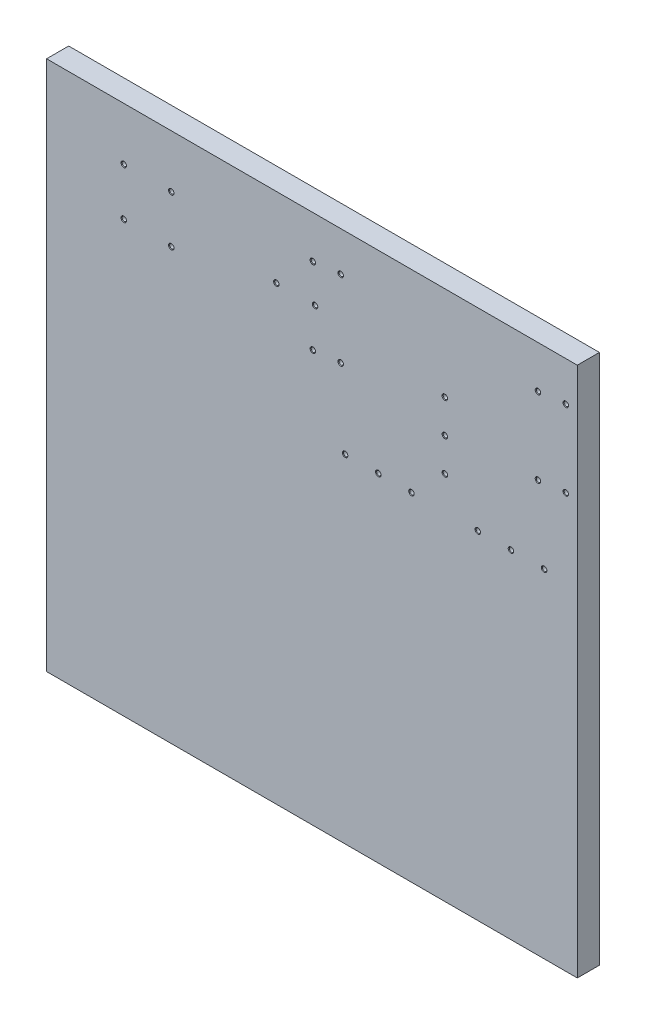
from build123d import *

# Parameters (mm, degrees)
SKETCH1_W                            = 304.8
SKETCH1_H                            = 304.8
BOSS_EXTRUDE1_DEPTH                  = 12.7
SKETCH2_W                            = 12.7
SKETCH2_H                            = 304.8
BOSS_EXTRUDE2_DEPTH                  = 304.8
SKETCH3_W                            = 609.6
SKETCH3_H                            = 12.7
BOSS_EXTRUDE3_DEPTH                  = 254
SKETCH4_W                            = 609.6
SKETCH4_H                            = 12.7
BOSS_EXTRUDE4_DEPTH                  = 50.8
F_8_0_199_DIAMETER_HOLE2_D           = 5.0546
F_8_0_199_DIAMETER_HOLE2_DEPTH       = 8.382
F_8_0_199_DIAMETER_HOLE2_CSINK_D     = 6.3246
F_8_0_199_DIAMETER_HOLE2_CSINK_ANGLE = 90
F_8_0_199_DIAMETER_HOLE2_TIP         = 1.518555042
F_8_0_199_DIAMETER_HOLE3_AT_2_COUNT  = 2
F_8_0_199_DIAMETER_HOLE3_AT_2_PITCH  = 32.173890346
LPATTERN1_COUNT                      = 2
LPATTERN1_PITCH                      = 258.572
LPATTERN1_COUNT_DIR2                 = 2
LPATTERN1_PITCH_DIR2                 = 88.138
F_8_0_199_DIAMETER_HOLE4_D           = 5.0546
F_8_0_199_DIAMETER_HOLE4_DEPTH       = 8.382
F_8_0_199_DIAMETER_HOLE4_CSINK_D     = 6.3246
F_8_0_199_DIAMETER_HOLE4_CSINK_ANGLE = 90
F_8_0_199_DIAMETER_HOLE4_TIP         = 1.518555042
F_8_0_199_DIAMETER_HOLE6_D           = 5.0546
F_8_0_199_DIAMETER_HOLE6_DEPTH       = 8.382
F_8_0_199_DIAMETER_HOLE6_CSINK_D     = 6.3246
F_8_0_199_DIAMETER_HOLE6_CSINK_ANGLE = 90
F_8_0_199_DIAMETER_HOLE6_TIP         = 1.518555042
SKETCH26_W                           = 609.6
SKETCH26_H                           = 609.6
BOSS_EXTRUDE5_DEPTH                  = 12.7


with BuildPart() as part:
    # Sketch1 → Boss-Extrude1 (new body)
    with BuildSketch(Plane.XY):
        with Locations((-60.739130435, 60.186956522)):
            Rectangle(SKETCH1_W, SKETCH1_H)
    extrude(amount=BOSS_EXTRUDE1_DEPTH)

    # Sketch2 → Boss-Extrude2 (add)
    with BuildSketch(Plane.ZY.offset(213.139130435)):
        with Locations((6.35, 60.186956522)):
            Rectangle(SKETCH2_W, SKETCH2_H)
    extrude(amount=BOSS_EXTRUDE2_DEPTH)

    # Sketch3 → Boss-Extrude3 (add)
    with BuildSketch(Plane.XZ.offset(92.213043478)):
        with Locations((-213.139130435, 6.35)):
            Rectangle(SKETCH3_W, SKETCH3_H)
    extrude(amount=BOSS_EXTRUDE3_DEPTH)

    # Sketch4 → Boss-Extrude4 (add)
    with BuildSketch(Plane(origin=(0, 212.586956522, 0), x_dir=(1, 0, 0), z_dir=(0, 1, 0))):
        with Locations((-213.139130435, -6.35)):
            Rectangle(SKETCH4_W, SKETCH4_H)
    extrude(amount=BOSS_EXTRUDE4_DEPTH)

    # #8 (0.199) Diameter Hole2
    with Locations(Plane.XY.offset(12.7)):
        with Locations((53.560869565, 41.390956522), (15.460869565, 41.390956522), (-22.639130435, 41.390956522), (-98.839130435, 41.390956522), (-136.939130435, 41.390956522), (-175.039130435, 41.390956522), (-60.485130435, 79.236956522), (-60.485130435, 117.336956522), (-60.485130435, 155.436956522)):
            CounterSinkHole(F_8_0_199_DIAMETER_HOLE2_D / 2, F_8_0_199_DIAMETER_HOLE2_CSINK_D / 2, depth=F_8_0_199_DIAMETER_HOLE2_DEPTH, counter_sink_angle=F_8_0_199_DIAMETER_HOLE2_CSINK_ANGLE)
            with Locations((0, 0, -(F_8_0_199_DIAMETER_HOLE2_DEPTH + F_8_0_199_DIAMETER_HOLE2_TIP / 2))):  # 118° drill point
                Cone(0, F_8_0_199_DIAMETER_HOLE2_D / 2, F_8_0_199_DIAMETER_HOLE2_TIP, mode=Mode.SUBTRACT)

    # Sketch15 → #8 (0.199) Diameter Hole3 (revolve, cut)
    with BuildSketch(Plane(origin=(78.452869565, 217.920956522, 12.7), x_dir=(0, -1, 0), z_dir=(1, 0, 0))):
        Polygon((0, 0), (0, 9.900555042), (2.5273, 8.382), (2.5273, 0.635), (3.1623, 0), align=None)
    f_8_0_199_diameter_hole3 = revolve(axis=Axis((78.452869565, 217.920956522, 19.05), (0, 0, -1)), mode=Mode.SUBTRACT)

    # #8 (0.199) Diameter Hole3 at 2: #8 (0.199) Diameter Hole3 ×2
    with Locations(*[Vector(-0.994719620654259, -0.102629802130995, 0) * (i * F_8_0_199_DIAMETER_HOLE3_AT_2_PITCH) for i in range(1, F_8_0_199_DIAMETER_HOLE3_AT_2_COUNT)]):
        add(f_8_0_199_diameter_hole3, mode=Mode.SUBTRACT)

    # LPattern1: 8 _0.199_ Diameter Hole3 2 × 2
    with Locations(*[(-i * LPATTERN1_PITCH, -j * LPATTERN1_PITCH_DIR2, 0) for i in range(LPATTERN1_COUNT) for j in range(LPATTERN1_COUNT_DIR2) if (i, j) != (0, 0)]):
        add(f_8_0_199_diameter_hole3, mode=Mode.SUBTRACT)

    # LPattern1 copy 1 sketch → LPattern1 copy 1 (revolve, cut)
    with BuildSketch(Plane(origin=(46.448869565, 126.480956522, 12.7), x_dir=(0, -1, 0), z_dir=(1, 0, 0))):
        Polygon((0, 0), (0, 9.900555042), (2.5273, 8.382), (2.5273, 0.635), (3.1623, 0), align=None)
    revolve(axis=Axis((46.448869565, 126.480956522, 19.05), (0, 0, -1)), mode=Mode.SUBTRACT)

    # LPattern1 copy 2 sketch → LPattern1 copy 2 (revolve, cut)
    with BuildSketch(Plane(origin=(-212.123130435, 214.618956522, 12.7), x_dir=(0, -1, 0), z_dir=(1, 0, 0))):
        Polygon((0, 0), (0, 9.900555042), (2.5273, 8.382), (2.5273, 0.635), (3.1623, 0), align=None)
    revolve(axis=Axis((-212.123130435, 214.618956522, 19.05), (0, 0, -1)), mode=Mode.SUBTRACT)

    # LPattern1 copy 3 sketch → LPattern1 copy 3 (revolve, cut)
    with BuildSketch(Plane(origin=(-212.123130435, 126.480956522, 12.7), x_dir=(0, -1, 0), z_dir=(1, 0, 0))):
        Polygon((0, 0), (0, 9.900555042), (2.5273, 8.382), (2.5273, 0.635), (3.1623, 0), align=None)
    revolve(axis=Axis((-212.123130435, 126.480956522, 19.05), (0, 0, -1)), mode=Mode.SUBTRACT)

    # #8 (0.199) Diameter Hole4
    with Locations(Plane.XY.offset(12.7)):
        with Locations((-209.583130435, 172.200956522), (-254.033130435, 172.200956522)):
            CounterSinkHole(F_8_0_199_DIAMETER_HOLE4_D / 2, F_8_0_199_DIAMETER_HOLE4_CSINK_D / 2, depth=F_8_0_199_DIAMETER_HOLE4_DEPTH, counter_sink_angle=F_8_0_199_DIAMETER_HOLE4_CSINK_ANGLE)
            with Locations((0, 0, -(F_8_0_199_DIAMETER_HOLE4_DEPTH + F_8_0_199_DIAMETER_HOLE4_TIP / 2))):  # 118° drill point
                Cone(0, F_8_0_199_DIAMETER_HOLE4_D / 2, F_8_0_199_DIAMETER_HOLE4_TIP, mode=Mode.SUBTRACT)

    # #8 (0.199) Diameter Hole6
    with Locations(Plane.XY.offset(12.7)):
        with Locations((-374.683130435, 202.680956522), (-429.293130435, 202.680956522), (-374.683130435, 148.070956522), (-429.293130435, 148.070956522)):
            CounterSinkHole(F_8_0_199_DIAMETER_HOLE6_D / 2, F_8_0_199_DIAMETER_HOLE6_CSINK_D / 2, depth=F_8_0_199_DIAMETER_HOLE6_DEPTH, counter_sink_angle=F_8_0_199_DIAMETER_HOLE6_CSINK_ANGLE)
            with Locations((0, 0, -(F_8_0_199_DIAMETER_HOLE6_DEPTH + F_8_0_199_DIAMETER_HOLE6_TIP / 2))):  # 118° drill point
                Cone(0, F_8_0_199_DIAMETER_HOLE6_D / 2, F_8_0_199_DIAMETER_HOLE6_TIP, mode=Mode.SUBTRACT)

    # Sketch26 → Boss-Extrude5 (add)
    with BuildSketch(Plane(origin=(0, 0, 0), x_dir=(-1, 0, 0), z_dir=(0, 0, -1))):
        with Locations((213.139130435, -41.413043478)):
            Rectangle(SKETCH26_W, SKETCH26_H)
    extrude(amount=BOSS_EXTRUDE5_DEPTH)


solid = part.part
